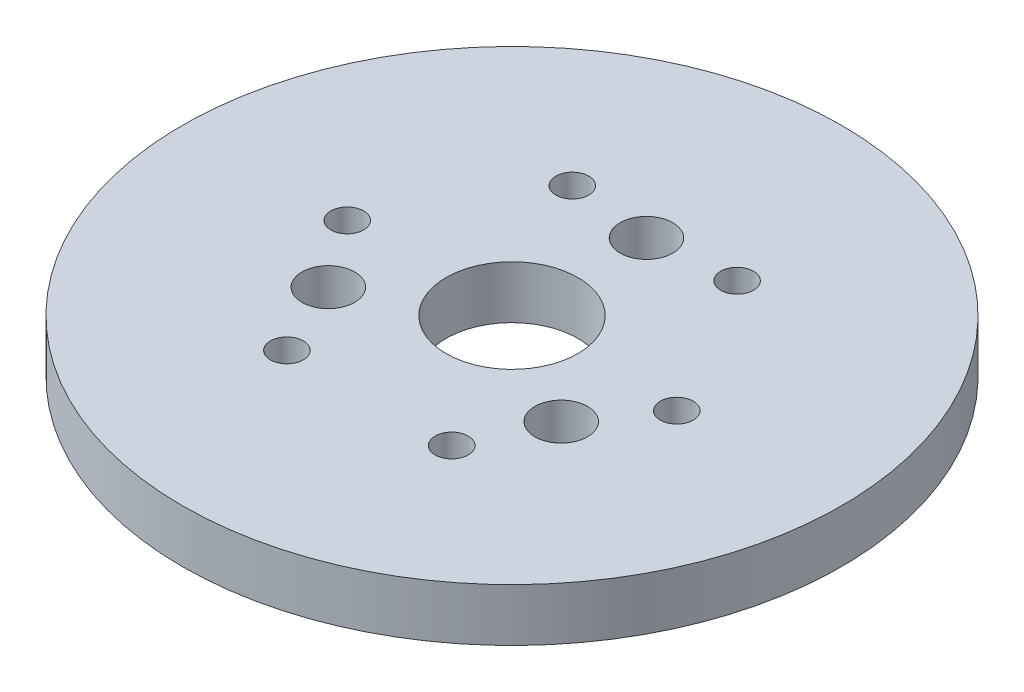
from build123d import *

# Parameters (mm, degrees)
SKETCH1_R           = 25
BOSS_EXTRUDE1_DEPTH = 4
SKETCH6_R           = 5
CUT_EXTRUDE3_DEPTH  = 20.7
SKETCH7_R           = 1.25
SKETCH7_R_2         = 2
CUT_EXTRUDE4_DEPTH  = 10


with BuildPart() as part:
    # Sketch1 → Boss-Extrude1 (new body)
    with BuildSketch(Plane(origin=(0, 0, 0), x_dir=(1, 0, 0), z_dir=(0, 1, 0))):
        Circle(SKETCH1_R)
    extrude(amount=BOSS_EXTRUDE1_DEPTH)

    # Sketch6 → Cut-Extrude3 (cut)
    with BuildSketch(Plane(origin=(0, 4, 0), x_dir=(1, 0, 0), z_dir=(0, 1, 0))):
        Circle(SKETCH6_R)
    extrude(amount=-CUT_EXTRUDE3_DEPTH, mode=Mode.SUBTRACT)

    # Sketch7 → Cut-Extrude4 (cut)
    with BuildSketch(Plane(origin=(0, 4, 0), x_dir=(1, 0, 0), z_dir=(0, 1, 0))):
        with Locations((-6.25, 10.825317547)):
            Circle(SKETCH7_R)
        with Locations((6.25, 10.825317547)):
            Circle(SKETCH7_R)
        with Locations((12.5, 0)):
            Circle(SKETCH7_R)
        with Locations((6.25, -10.825317547)):
            Circle(SKETCH7_R)
        with Locations((-6.25, -10.825317547)):
            Circle(SKETCH7_R)
        with Locations((-12.5, 0)):
            Circle(SKETCH7_R)
        with Locations((0, 10.2)):
            Circle(SKETCH7_R_2)
        with Locations((8.833459119, -5.1)):
            Circle(SKETCH7_R_2)
        with Locations((-8.833459119, -5.1)):
            Circle(SKETCH7_R_2)
    extrude(amount=-CUT_EXTRUDE4_DEPTH, mode=Mode.SUBTRACT)


solid = part.part
